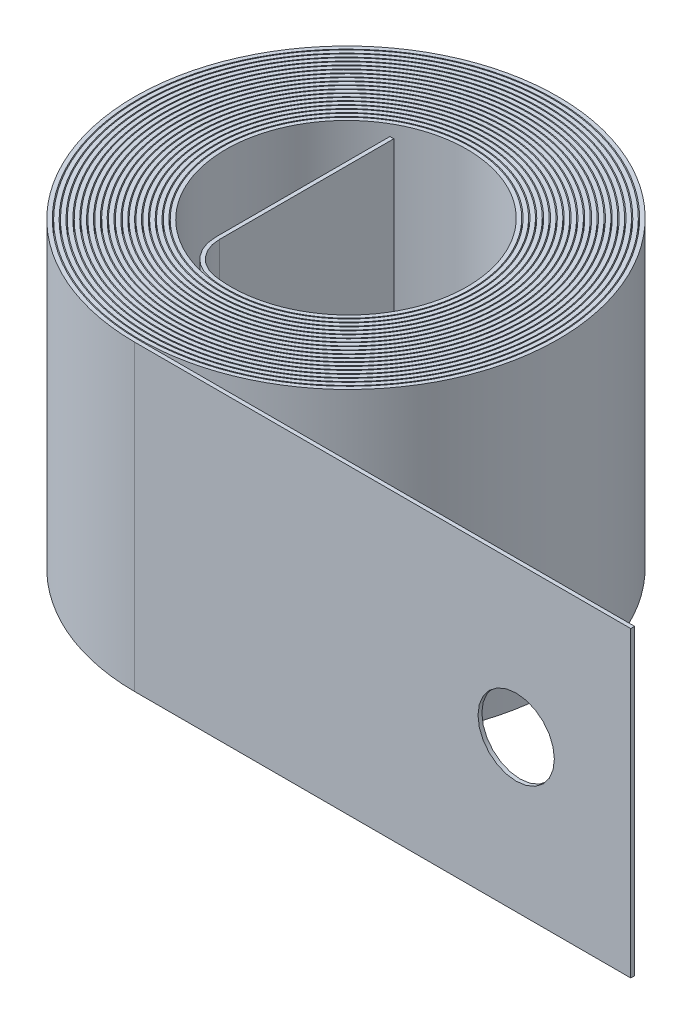
from build123d import *

# Parameters (mm, degrees)
EXTRUDE_THIN1_DEPTH = 7.9248
CUT_EXTRUDE1_REACH  = 19.203
SKETCH3_R           = 1
CUT_EXTRUDE2_REACH  = 20.849
SKETCH4_R           = 1


# Read off the part's stored shape, not the designer's step: Extrude-Thin1
with BuildPart() as part:
    # Extrude-Thin1 outline → Extrude-Thin1 (new body)
    with BuildSketch(Plane(origin=(0, 0, 0), x_dir=(1, 0, 0), z_dir=(0, 1, 0))):
        with BuildLine():
            Line((-1.210137691, -2.148511851), (-1.210137691, 2.416990738))
            Line((-1.210137691, 2.416990738), (-1.311737691, 2.416990738))
            Line((-1.311737691, 2.416990738), (-1.311737691, -2.148511851))
            ThreePointArc((-1.311737691, -2.148511851), (-1.073564108, -2.796293072), (-0.47249667, -3.135505544))
            add(Edge.make_bspline(
                [(0, -5.588), (-0.868617644, -5.584858073), (-1.73504116, -5.375606078), (-3.281339184, -4.590230038), (-3.96001627, -4.014736048), (-4.986347668, -2.620339653), (-5.333217056, -1.802536567), (-5.622523806, -0.098464806), (-5.564754712, 0.786471272), (-5.057851198, 2.435861002), (-4.609130852, 3.199033709), (-3.416788601, 4.442276836), (-2.674110908, 4.921390914), (-1.052864693, 5.494808097), (-0.175567394, 5.588682273), (1.527475673, 5.372300476), (2.35189537, 5.062232649), (3.773370618, 4.104875727), (4.369328184, 3.458349635), (5.207141535, 1.966653451), (5.448360757, 1.12265657), (5.525888712, -0.583526265), (5.362156452, -1.444380355), (4.665474672, -3.000562818), (4.13308643, -3.694685196), (2.813381258, -4.769610173), (2.027106139, -5.149589354), (0.367874111, -5.515742025), (-0.50378424, -5.501648928), (-2.147634466, -5.08340789), (-2.918548795, -4.67960512), (-4.196610968, -3.568842401), (-4.7027746, -2.862763673), (-5.343837892, -1.298679477), (-5.47825551, -0.441901538), (-5.347854416, 1.240483382), (-5.083156875, 2.064779454), (-4.211766629, 3.506383295), (-3.605770383, 4.122576567), (-2.181737737, 5.016897492), (-1.36482259, 5.294344008), (0.306338555, 5.452624756), (1.159279051, 5.333354931), (2.720431618, 4.724416775), (3.427432931, 4.235241645), (4.546138944, 2.991582651), (4.95698545, 2.238082004), (5.396296112, 0.627056872), (5.424436382, -0.229205729), (5.093075872, -1.862857532), (4.733852701, -2.638976209), (3.705167926, -3.946900128), (3.036524125, -4.477697125), (1.532269479, -5.182205338), (0.697840367, -5.355384635), (-0.959621844, -5.308410474), (-1.781362519, -5.088313158), (-3.238143591, -4.302522265), (-3.87205682, -3.737458847), (-4.818301267, -2.382981861), (-5.129910313, -1.594636085), (-5.365700678, 0.037759264), (-5.289717362, 0.880532624), (-4.767306799, 2.441859388), (-4.321305581, 3.159200996), (-3.15475764, 4.316862225), (-2.435134676, 4.756292604), (-0.875430553, 5.264931378), (-0.03657216, 5.33376153), (1.582384587, 5.08725937), (2.361222934, 4.772138637), (3.694088469, 3.825742942), (4.247087185, 3.195222164), (5.010743487, 1.753191425), (5.220822584, 0.942815514), (5.254513678, -0.685660443), (5.078118893, -1.502489717), (4.377284242, -2.969582907), (3.853408696, -3.618710756), (2.570094566, -4.612248003), (1.811669033, -4.955897768), (0.22155011, -5.265785125), (-0.608899104, -5.23180012), (-2.165736633, -4.794445117), (-2.89091574, -4.391435076), (-4.082709843, -3.30277507), (-4.548408279, -2.617988767), (-5.122419242, -1.112461059), (-5.230302211, -0.292901061), (-5.066407663, 1.307038466), (-4.794777403, 2.086171874), (-3.930599602, 3.439112177), (-3.338742642, 4.011874147), (-1.961054187, 4.830302672), (-1.176307385, 5.075347543), (0.41932975, 5.186747882), (1.228973971, 5.053035905), (2.701615399, 4.436246258), (3.363471336, 3.953667736), (4.399640808, 2.742838852), (4.773160848, 2.015545737), (5.153578198, 0.470972951), (5.160197685, -0.345097137), (4.806180326, -1.892927886), (4.445838664, -2.623485435), (3.43555851, -3.844610067), (2.786423165, -4.334236986), (1.337663866, -4.969554279), (0.539177921, -5.114766907), (-1.037608124, -5.031012943), (-1.814679208, -4.802131166), (-3.182896429, -4.019823585), (-3.772984903, -3.467024992), (-4.641747408, -2.155519382), (-4.919759978, -1.397846243), (-5.105733272, 0.16131959), (-5.013568285, 0.961593668), (-4.479652733, 2.435135126), (-4.038337013, 3.107259639), (-2.901032031, 4.1813876), (-2.205943373, 4.582567301), (-0.709938995, 5.029808658), (0.089804105, 5.075540108), (1.624269142, 4.802907417), (2.357797454, 4.484775161), (3.603486488, 3.553085758), (4.114687129, 2.940271043), (4.807151216, 1.550604984), (4.987891927, 0.774846421), (4.981608073, -0.774846421), (4.794607914, -1.547571861), (4.093553083, -2.926352414), (3.58006269, -3.531340779), (2.3363018, -4.445953272), (1.607013118, -4.754879624), (0.087722736, -5.012123763), (-0.701090506, -4.960260106), (-2.171013305, -4.507797289), (-2.85098191, -4.107569739), (-3.958397968, -3.044545608), (-4.38499503, -2.382592366), (-4.895231067, -0.937925627), (-4.978490395, -0.156345614), (-4.785065795, 1.360565413), (-4.508552105, 2.094715549), (-3.655388183, 3.360254953), (-3.07941968, 3.890667872), (-1.750901738, 4.636041892), (-0.999398225, 4.850438534), (0.519468069, 4.918764217), (1.285645099, 4.772659444), (2.670374429, 4.15197761), (3.287854474, 3.677902545), (4.243803782, 2.503169645), (4.581542436, 1.803440534), (4.906604324, 0.32719407), (4.893693026, -0.448167463), (4.521021086, -1.910095656), (4.161570067, -2.595526677), (3.17330498, -3.731580051), (2.545276578, -4.181328965), (1.15445901, -4.75062287), (0.392762215, -4.869741803), (-1.102588414, -4.753137187), (-1.835077235, -4.517524048), (-3.115820553, -3.742549888), (-3.663086035, -3.203810116), (-4.457072198, -1.938223375), (-4.703190009, -1.212374061), (-4.843088382, 0.272147706), (-4.736779228, 1.029660246), (-4.195336667, 2.415837061), (-3.760643812, 3.043427069), (-2.655944605, 4.036187273), (-1.986813073, 4.40059752), (-0.556536862, 4.789888219), (0.203486927, 4.814483803), (1.65319986, 4.51971101), (2.34176196, 4.2005917), (3.501837462, 3.287288962), (3.972457948, 2.693833333), (4.596781433, 1.35911505), (4.750015062, 0.618901883), (4.707643423, -0.851074367), (4.512090707, -1.579691273), (3.814706711, -2.871074674), (3.313436628, -3.43284302), (2.112291498, -4.27109899), (1.413364635, -4.54694868), (-0.033518132, -4.755220852), (-0.780342533, -4.687500166), (-2.163592459, -4.223918245), (-2.798945098, -3.828437147), (-3.823993791, -2.794501742), (-4.212904049, -2.156867748), (-4.662714182, -0.775240462), (-4.723281704, -0.032331028), (-4.504297737, 1.401113137), (-4.22493636, 2.090532571), (-3.386529142, 3.27006625), (-2.828153247, 3.759271631), (-1.551520179, 4.434521036), (-0.834268037, 4.620055533), (0.606721958, 4.649144104), (1.329335289, 4.492694988), (2.626892116, 3.872045065), (3.200831793, 3.40834603), (4.078987002, 2.272880318), (4.382532906, 1.602011361), (4.655832547, 0.195831308), (4.625392227, -0.538379093), (4.238057186, -1.914467702), (3.881483405, -2.555277694), (2.918769208, -3.608112011), (2.313394211, -4.019328171), (0.982842254, -4.525843539), (0.258710212, -4.620765838), (-1.154589938, -4.475253664), (-1.842657512, -4.234952109), (-3.037151911, -3.47110907), (-3.542657406, -2.948179901), (-4.264669845, -1.731351967), (-4.480630314, -1.038412416), (-4.578234175, 0.370190427), (-4.459820884, 1.084753504), (-3.914800624, 2.384128305), (-3.488636819, 2.967933916), (-2.419816734, 3.881605755), (-1.778006927, 4.210774043), (-0.415356174, 4.545622296), (0.304417096, 4.551059984), (1.669262281, 4.238133408), (2.313273822, 3.920032274), (3.389426183, 3.028727788), (3.820739924, 2.456234776), (4.380057271, 1.17892861), (4.507642412, 0.475119724), (4.43309072, -0.914349778), (4.231031523, -1.598927494), (3.541163274, -2.803966474), (3.053909326, -3.32349736), (1.898339562, -4.088066864), (1.230935984, -4.332525298), (-0.14209781, -4.495541394), (-0.846654603, -4.413991255), (-2.143616583, -3.943256849), (-2.735016646, -3.554458145), (-3.679826487, -2.552980232), (-4.032513393, -1.941095676), (-4.425314051, -0.624558229), (-4.465140065, 0.079062035), (-4.224569985, 1.428745693), (-3.944380765, 2.073759601), (-3.124410267, 3.16881313), (-2.585284273, 3.618010173), (-1.363135685, 4.226153052), (-0.681075198, 4.384641927), (0.681075198, 4.378358073), (1.360102561, 4.21360975), (2.571365644, 3.596876127), (3.102665288, 3.145389332), (3.905558877, 2.052263947), (4.176542191, 1.411489669), (4.40172372, 0.076980666), (4.355765499, -0.61570974), (3.957743381, -1.906165608), (3.606008627, -2.502930111), (2.672302616, -3.474519099), (2.091073823, -3.848599147), (0.822986561, -4.295654036), (0.137123835, -4.368298517), (-1.193655154, -4.197831114), (-1.837535729, -3.954871562), (-2.947139287, -3.20590064), (-3.412007561, -2.700489724), (-4.064942248, -1.535150025), (-4.25251631, -0.876139879), (-4.311639723, 0.455409872), (-4.183162435, 1.126909844), (-3.638480549, 2.34018604), (-3.222718661, 2.881023752), (-2.192958032, 3.717997392), (-1.579774929, 4.013495517), (-0.286514029, 4.297466623), (0.392550687, 4.285737124), (1.672556845, 3.958634281), (2.272504559, 3.643535014), (3.266549134, 2.77776756), (3.659883331, 2.227789484), (4.157407849, 1.010238543), (4.261228096, 0.343622893), (4.158419958, -0.964693445), (3.951891221, -1.605375015), (3.273333147, -2.725257812), (2.80184985, -3.203595503), (1.694709013, -3.897246903), (1.059925533, -4.11203601), (-0.237956857, -4.233552009), (-0.900041441, -4.140203524), (-2.111242505, -3.666256559), (-2.659421207, -3.286045979), (-3.526235603, -2.320306559), (-3.84420959, -1.735544142), (-4.183480326, -0.486016851), (-4.204531225, 0.177768126), (-3.946346147, 1.443542188), (-3.667330698, 2.044547712), (-2.869409998, 3.056774797), (-2.351142541, 3.467218771), (-1.185960622, 4.011357528), (-0.539963398, 4.144645488), (0.74252689, 4.106876371), (1.378020027, 3.935868256), (2.504005757, 3.326891157), (2.993629219, 2.889414408), (3.723896713, 1.841601134), (3.963987046, 1.232093186), (4.144741027, -0.029276999), (4.085282971, -0.680152442), (3.68052969, -1.88532553), (3.335568714, -2.4386892), (2.434245844, -3.331125358), (1.878600819, -3.669515495), (0.675050371, -4.060496987), (0.028089896, -4.112801878), (-1.219841687, -3.921336103), (-1.819842207, -3.677734084), (-2.846044031, -2.947315342), (-3.271456077, -2.461084331), (-3.858298584, -1.349848933), (-4.019288481, -0.72572056), (-4.043774531, 0.527783473), (-3.907271083, 1.15618086), (-3.366805888, 2.284201324), (-2.963283364, 2.782952829), (-1.975666069, 3.545726), (-1.39235369, 3.809168043), (-0.170112506, 4.045879968), (0.467859082, 4.018984334), (1.663198771, 3.681669256), (2.219639648, 3.371531734), (3.133514178, 2.534763346), (3.490248062, 2.008799654), (3.929267835, 0.853223449), (4.011229464, 0.224519363), (3.884099664, -1.002141409), (3.675126814, -1.59914315), (3.011618538, -2.635191645), (2.55761716, -3.073440665), (1.501649747, -3.699037018), (0.900517447, -3.885913085), (-0.321051104, -3.969720468), (-0.940533037, -3.866605862), (-2.06664121, -3.393354989), (-2.572396495, -3.023605902), (-3.363570702, -2.096794616), (-3.648387238, -1.540468116), (-3.937666394, -0.359739398), (-3.941922283, 0.263737055), (-3.670086489, 1.445596676), (-3.394225884, 2.003062209), (-2.621897066, 2.934242299), (-2.126046386, 3.307242863), (-1.020193355, 3.790560262), (-0.411061527, 3.900517917), (0.791091432, 3.835168497), (1.383175781, 3.659931879), (2.425036518, 3.062502963), (2.874009816, 2.640793661), (3.53438632, 1.641159741), (3.745290617, 1.064025724), (3.885349516, -0.12287603), (3.814414224, -0.731715537), (3.406860966, -1.852098041), (3.070579277, -2.362773654), (2.204928433, -3.178265374), (1.676247979, -3.482459485), (0.539177463, -3.820819444), (-0.068319965, -3.854740022), (-1.233222244, -3.646232552), (-1.789721748, -3.40398637), (-2.734139772, -2.695734776), (-3.121333218, -2.230297503), (-3.645154888, -1.175666385), (-3.781391927, -0.587303975), (-3.775108073, 0.587303975), (-3.632611586, 1.172633262), (-3.100199172, 2.216378875), (-2.710715975, 2.673989797), (-1.768226094, 3.365164481), (-1.21596622, 3.598204759), (-0.066238596, 3.791323677), (0.530328974, 3.751270892), (1.641317911, 3.407689473), (2.154878312, 3.104447514), (2.990640231, 2.300059623), (3.312203263, 1.799555281), (3.696077005, 0.708047496), (3.758106639, 0.117902055), (3.610596434, -1.026744894), (3.401191018, -1.580355908), (2.756413097, -2.534023622), (2.321559768, -2.93334725), (1.319398311, -3.493842604), (0.752881533, -3.654594087), (-0.391351675, -3.704515228), (-0.968174588, -3.593665426), (-2.00999765, -3.124983487), (-2.47419303, -2.767534777), (-3.192191002, -1.882746419), (-3.445448598, -1.356109324), (-3.688328922, -0.245833988), (-3.677781222, 0.33693391), (-3.396247476, 1.435018035), (-3.125499961, 1.949482441), (-2.382230139, 2.801518217), (-1.91030239, 3.138437696), (-0.866018076, 3.564192827), (-0.29448357, 3.652714389), (0.826798476, 3.563702729), (1.375672795, 3.386258394), (2.334695071, 2.804116406), (2.744104971, 2.399889584), (3.337421609, 1.45119465), (3.52088201, 0.907477004), (3.624015635, -0.203766008), (3.54362782, -0.770422636), (3.137176451, -1.806647948), (2.811448147, -2.275415345), (1.984668512, -3.016283932), (1.48427521, -3.28782166), (0.415496841, -3.577072433), (-0.152049324, -3.594578646), (-1.233884516, -3.372981285), (-1.747333463, -3.134069697), (-2.611712131, -2.451531034), (-2.961979594, -2.00845175), (-3.425933623, -1.012806193), (-3.539275915, -0.461024913), (-3.50610932, 0.633979413), (-3.359645804, 1.176348781), (-2.839075602, 2.13693684), (-2.465392189, 2.554415419), (-1.57091077, 3.176694436), (-1.050821736, 3.381025413), (0.025035867, 3.534261201), (0.57996235, 3.483065776), (1.607058602, 3.137141136), (2.078433302, 2.842700281), (2.838256925, 2.073989946), (3.12612694, 1.600333891), (3.458279792, 0.57486028), (3.502322053, 0.023848763), (3.33837447, -1.038570237), (3.130531807, -1.549151843), (2.508101542, -2.422021811), (2.094015414, -2.783640523), (1.148177687, -3.282076133), (0.617173083, -3.41852143), (-0.448844989, -3.438404957), (-0.983026431, -3.321847177), (-1.941510533, -2.861566711), (-2.365073865, -2.518220699), (-3.012464999, -1.678451821), (-3.235803181, -1.182696018), (-3.43592739, -0.144393705), (-3.412576441, 0.397339072), (-3.125281326, 1.411929839), (-2.861580063, 1.884001601), (-2.150757484, 2.658916345), (-1.704205098, 2.961167954), (-0.723604644, 3.332692132), (-0.190328514, 3.401693091), (0.84969288, 3.292945665), (1.355628788, 3.11530152), (2.233231379, 2.552128005), (2.604223924, 2.167054419), (3.133404191, 1.271947527), (3.291195856, 0.762622479), (3.361206761, -0.271911781), (3.273390841, -0.79631257), (2.871909355, -1.749154116), (2.558574985, -2.176859075), (1.773772498, -2.845535649), (1.302929306, -3.086000433), (0.304122621, -3.329710492), (-0.223057013, -3.332784581), (-1.221931071, -3.10203957), (-1.692850596, -2.868419494), (-2.479058415, -2.215066344), (-2.793745801, -1.795857997), (-3.201063253, -0.861458099), (-3.293393423, -0.347003331), (-3.237246274, 0.667833086), (-3.088832235, 1.167424068), (-2.583842652, 2.046106563), (-2.227677995, 2.424522273), (-1.38397992, 2.980705776), (-0.897115465, 3.158055936), (0.10365425, 3.275157638), (0.616776472, 3.214837193), (1.560579498, 2.870465082), (1.990530661, 2.586700408), (2.676704262, 1.856876634), (2.932405576, 1.411400282), (3.216324838, 0.453796697), (3.244339979, -0.057577895), (3.06789512, -1.037698795), (2.863591974, -1.505683895), (2.267059285, -2.299466414), (1.875310734, -2.624656262), (0.846026979, -3.134591699), (0.171179762, -3.240345896), (-0.47249667, -3.135505544)],
                knots=[0, 0, 0, 0, 0.00390625, 0.00390625, 0.0078125, 0.0078125, 0.01171875, 0.01171875, 0.015625, 0.015625, 0.01953125, 0.01953125, 0.0234375, 0.0234375, 0.02734375, 0.02734375, 0.03125, 0.03125, 0.03515625, 0.03515625, 0.0390625, 0.0390625, 0.04296875, 0.04296875, 0.046875, 0.046875, 0.05078125, 0.05078125, 0.0546875, 0.0546875, 0.05859375, 0.05859375, 0.0625, 0.0625, 0.06640625, 0.06640625, 0.0703125, 0.0703125, 0.07421875, 0.07421875, 0.078125, 0.078125, 0.08203125, 0.08203125, 0.0859375, 0.0859375, 0.08984375, 0.08984375, 0.09375, 0.09375, 0.09765625, 0.09765625, 0.1015625, 0.1015625, 0.10546875, 0.10546875, 0.109375, 0.109375, 0.11328125, 0.11328125, 0.1171875, 0.1171875, 0.12109375, 0.12109375, 0.125, 0.125, 0.12890625, 0.12890625, 0.1328125, 0.1328125, 0.13671875, 0.13671875, 0.140625, 0.140625, 0.14453125, 0.14453125, 0.1484375, 0.1484375, 0.15234375, 0.15234375, 0.15625, 0.15625, 0.16015625, 0.16015625, 0.1640625, 0.1640625, 0.16796875, 0.16796875, 0.171875, 0.171875, 0.17578125, 0.17578125, 0.1796875, 0.1796875, 0.18359375, 0.18359375, 0.1875, 0.1875, 0.19140625, 0.19140625, 0.1953125, 0.1953125, 0.19921875, 0.19921875, 0.203125, 0.203125, 0.20703125, 0.20703125, 0.2109375, 0.2109375, 0.21484375, 0.21484375, 0.21875, 0.21875, 0.22265625, 0.22265625, 0.2265625, 0.2265625, 0.23046875, 0.23046875, 0.234375, 0.234375, 0.23828125, 0.23828125, 0.2421875, 0.2421875, 0.24609375, 0.24609375, 0.25, 0.25, 0.25390625, 0.25390625, 0.2578125, 0.2578125, 0.26171875, 0.26171875, 0.265625, 0.265625, 0.26953125, 0.26953125, 0.2734375, 0.2734375, 0.27734375, 0.27734375, 0.28125, 0.28125, 0.28515625, 0.28515625, 0.2890625, 0.2890625, 0.29296875, 0.29296875, 0.296875, 0.296875, 0.30078125, 0.30078125, 0.3046875, 0.3046875, 0.30859375, 0.30859375, 0.3125, 0.3125, 0.31640625, 0.31640625, 0.3203125, 0.3203125, 0.32421875, 0.32421875, 0.328125, 0.328125, 0.33203125, 0.33203125, 0.3359375, 0.3359375, 0.33984375, 0.33984375, 0.34375, 0.34375, 0.34765625, 0.34765625, 0.3515625, 0.3515625, 0.35546875, 0.35546875, 0.359375, 0.359375, 0.36328125, 0.36328125, 0.3671875, 0.3671875, 0.37109375, 0.37109375, 0.375, 0.375, 0.37890625, 0.37890625, 0.3828125, 0.3828125, 0.38671875, 0.38671875, 0.390625, 0.390625, 0.39453125, 0.39453125, 0.3984375, 0.3984375, 0.40234375, 0.40234375, 0.40625, 0.40625, 0.41015625, 0.41015625, 0.4140625, 0.4140625, 0.41796875, 0.41796875, 0.421875, 0.421875, 0.42578125, 0.42578125, 0.4296875, 0.4296875, 0.43359375, 0.43359375, 0.4375, 0.4375, 0.44140625, 0.44140625, 0.4453125, 0.4453125, 0.44921875, 0.44921875, 0.453125, 0.453125, 0.45703125, 0.45703125, 0.4609375, 0.4609375, 0.46484375, 0.46484375, 0.46875, 0.46875, 0.47265625, 0.47265625, 0.4765625, 0.4765625, 0.48046875, 0.48046875, 0.484375, 0.484375, 0.48828125, 0.48828125, 0.4921875, 0.4921875, 0.49609375, 0.49609375, 0.5, 0.5, 0.50390625, 0.50390625, 0.5078125, 0.5078125, 0.51171875, 0.51171875, 0.515625, 0.515625, 0.51953125, 0.51953125, 0.5234375, 0.5234375, 0.52734375, 0.52734375, 0.53125, 0.53125, 0.53515625, 0.53515625, 0.5390625, 0.5390625, 0.54296875, 0.54296875, 0.546875, 0.546875, 0.55078125, 0.55078125, 0.5546875, 0.5546875, 0.55859375, 0.55859375, 0.5625, 0.5625, 0.56640625, 0.56640625, 0.5703125, 0.5703125, 0.57421875, 0.57421875, 0.578125, 0.578125, 0.58203125, 0.58203125, 0.5859375, 0.5859375, 0.58984375, 0.58984375, 0.59375, 0.59375, 0.59765625, 0.59765625, 0.6015625, 0.6015625, 0.60546875, 0.60546875, 0.609375, 0.609375, 0.61328125, 0.61328125, 0.6171875, 0.6171875, 0.62109375, 0.62109375, 0.625, 0.625, 0.62890625, 0.62890625, 0.6328125, 0.6328125, 0.63671875, 0.63671875, 0.640625, 0.640625, 0.64453125, 0.64453125, 0.6484375, 0.6484375, 0.65234375, 0.65234375, 0.65625, 0.65625, 0.66015625, 0.66015625, 0.6640625, 0.6640625, 0.66796875, 0.66796875, 0.671875, 0.671875, 0.67578125, 0.67578125, 0.6796875, 0.6796875, 0.68359375, 0.68359375, 0.6875, 0.6875, 0.69140625, 0.69140625, 0.6953125, 0.6953125, 0.69921875, 0.69921875, 0.703125, 0.703125, 0.70703125, 0.70703125, 0.7109375, 0.7109375, 0.71484375, 0.71484375, 0.71875, 0.71875, 0.72265625, 0.72265625, 0.7265625, 0.7265625, 0.73046875, 0.73046875, 0.734375, 0.734375, 0.73828125, 0.73828125, 0.7421875, 0.7421875, 0.74609375, 0.74609375, 0.75, 0.75, 0.75390625, 0.75390625, 0.7578125, 0.7578125, 0.76171875, 0.76171875, 0.765625, 0.765625, 0.76953125, 0.76953125, 0.7734375, 0.7734375, 0.77734375, 0.77734375, 0.78125, 0.78125, 0.78515625, 0.78515625, 0.7890625, 0.7890625, 0.79296875, 0.79296875, 0.796875, 0.796875, 0.80078125, 0.80078125, 0.8046875, 0.8046875, 0.80859375, 0.80859375, 0.8125, 0.8125, 0.81640625, 0.81640625, 0.8203125, 0.8203125, 0.82421875, 0.82421875, 0.828125, 0.828125, 0.83203125, 0.83203125, 0.8359375, 0.8359375, 0.83984375, 0.83984375, 0.84375, 0.84375, 0.84765625, 0.84765625, 0.8515625, 0.8515625, 0.85546875, 0.85546875, 0.859375, 0.859375, 0.86328125, 0.86328125, 0.8671875, 0.8671875, 0.87109375, 0.87109375, 0.875, 0.875, 0.87890625, 0.87890625, 0.8828125, 0.8828125, 0.88671875, 0.88671875, 0.890625, 0.890625, 0.89453125, 0.89453125, 0.8984375, 0.8984375, 0.90234375, 0.90234375, 0.90625, 0.90625, 0.91015625, 0.91015625, 0.9140625, 0.9140625, 0.91796875, 0.91796875, 0.921875, 0.921875, 0.92578125, 0.92578125, 0.9296875, 0.9296875, 0.93359375, 0.93359375, 0.9375, 0.9375, 0.94140625, 0.94140625, 0.9453125, 0.9453125, 0.94921875, 0.94921875, 0.953125, 0.953125, 0.95703125, 0.95703125, 0.9609375, 0.9609375, 0.96484375, 0.96484375, 0.96875, 0.96875, 0.97265625, 0.97265625, 0.9765625, 0.9765625, 0.98046875, 0.98046875, 0.984375, 0.984375, 0.98828125, 0.98828125, 0.9921875, 0.9921875, 0.99609375, 0.99609375, 1.001252042, 1.001252042, 1.001252042, 1.001252042], degree=3))
            Line((0, -5.588), (13, -5.588))
            Line((13, -5.588), (13, -5.4864))
            Line((13, -5.4864), (2e-09, -5.486399323))
            add(Edge.make_bspline(
                [(2e-09, -5.486399323), (-0.853611774, -5.483253465), (-1.705845294, -5.277112535), (-3.224868001, -4.504324252), (-3.891946648, -3.937616338), (-4.898758153, -2.56613554), (-5.238763626, -1.761208065), (-5.519946092, -0.086221473), (-5.461346747, 0.784090377), (-4.959309288, 2.403545261), (-4.516004753, 3.153029608), (-3.340754752, 4.371024941), (-2.608810437, 4.839935142), (-1.013861167, 5.397545116), (-0.150693766, 5.486647952), (1.521617925, 5.26698932), (2.331094735, 4.958562576), (3.72308646, 4.011283852), (4.306075514, 3.372620813), (5.121222131, 1.902711646), (5.353929181, 1.071444204), (5.420027574, -0.605119061), (5.253946647, -1.450678724), (4.559487709, -2.974855208), (4.031504561, -3.653963572), (2.727571505, -4.700537471), (1.951782283, -5.068654687), (0.319189971, -5.415626204), (-0.537752502, -5.395178701), (-2.148931728, -4.97085062), (-2.903617388, -4.567574251), (-4.149118566, -3.465347897), (-4.640635125, -2.766769341), (-5.255560355, -1.224600819), (-5.379802179, -0.381044524), (-5.23495758, 1.269923335), (-4.966673376, 2.077681991), (-4.095702432, 3.484223797), (-3.493612962, 4.083698916), (-2.085229876, 4.946079397), (-1.27918173, 5.209906427), (0.363711724, 5.345752836), (1.200747259, 5.218747019), (2.726205654, 4.601610621), (3.41525059, 4.112303789), (4.497679566, 2.876758153), (4.892018941, 2.131003383), (5.301669482, 0.543308778), (5.318089854, -0.298616514), (4.969819529, -1.897889811), (4.606165117, -2.655730091), (3.577118159, -3.92475593), (2.912461453, -4.436870145), (1.42499989, -5.105627648), (0.602452457, -5.263465547), (-1.023889011, -5.191191383), (-1.827989737, -4.962300205), (-3.245145009, -4.167108379), (-3.859038821, -3.601794221), (-4.764902708, -2.256232613), (-5.058095415, -1.476511636), (-5.26092435, 0.129872352), (-5.17192538, 0.956607799), (-4.630918264, 2.479572474), (-4.180131521, 3.176489741), (-3.013603306, 4.29086866), (-2.298670007, 4.709518023), (-0.758188364, 5.178645347), (0.067159262, 5.230580452), (1.651022945, 4.956549434), (2.410018034, 4.63200982), (3.698625448, 3.67609222), (4.229325145, 3.045802297), (4.948373535, 1.614773075), (5.138211594, 0.814534598), (5.136121941, -0.78405099), (4.945783118, -1.582617392), (4.225645945, -3.006522254), (3.697199019, -3.632783042), (2.415546808, -4.578356889), (1.663155813, -4.899125638), (0.095946043, -5.166057911), (-0.718791272, -5.113918826), (-2.235591691, -4.647667682), (-2.938351266, -4.235139572), (-4.080787967, -3.13805084), (-4.521818449, -2.454616736), (-5.04713852, -0.963471838), (-5.133171244, -0.156172303), (-4.931402072, 1.408912291), (-4.645372565, 2.167114052), (-3.762332054, 3.471408368), (-3.166743588, 4.018683714), (-1.793669798, 4.784434009), (-1.016940901, 5.004628906), (0.550918545, 5.07020451), (1.342141736, 4.917490397), (2.769014597, 4.271492869), (3.405611857, 3.779897153), (4.387110116, 2.563035198), (4.733635748, 1.838871125), (5.061688386, 0.313320894), (5.045188336, -0.487801498), (4.652146624, -1.99488071), (4.277513259, -2.701491931), (3.250080405, -3.868117868), (2.59871412, -4.329589752), (1.15883553, -4.90774726), (0.370961992, -5.026401828), (-1.172115433, -4.894766194), (-1.927631979, -4.646548204), (-3.243777021, -3.835934344), (-3.805626236, -3.27527294), (-4.614452699, -1.961474485), (-4.863319335, -1.209354813), (-4.993916878, 0.324973128), (-4.877817209, 1.107115603), (-4.304859512, 2.533266384), (-3.849993188, 3.178196239), (-2.698596258, 4.191832074), (-2.003449652, 4.562271705), (-0.521860866, 4.94836804), (0.26411413, 4.966217237), (1.758036867, 4.644672404), (2.466553389, 4.307470507), (3.653534108, 3.349707069), (4.133502615, 2.730868611), (4.761081598, 1.343989471), (4.910828954, 0.576825154), (4.847056201, -0.941165146), (4.635861072, -1.69216519), (3.897029822, -3.016393107), (3.371413484, -3.590828078), (2.118006734, -4.439079031), (1.39149375, -4.714896201), (-0.106667392, -4.907757816), (-0.878066649, -4.827184222), (-2.29990567, -4.325987904), (-2.95119613, -3.907625763), (-3.993192128, -2.822164058), (-4.385684927, -2.156718859), (-4.826664846, -0.721206551), (-4.87750962, 0.048175683), (-4.625590701, 1.525636045), (-4.325260866, 2.234160599), (-3.436980862, 3.437706014), (-2.851022398, 3.934227023), (-1.518677798, 4.607761539), (-0.773409365, 4.787024803), (0.716568238, 4.788710718), (1.461285218, 4.613663757), (2.789906024, 3.945782513), (3.374957787, 3.455223386), (4.258966403, 2.2631214), (4.559982474, 1.563109475), (4.812245477, 0.103575711), (4.766036148, -0.655496195), (4.335150723, -2.069542695), (3.952966819, -2.725258762), (2.933708035, -3.791857507), (2.298541655, -4.204530435), (0.911031081, -4.697160751), (0.159597363, -4.779588716), (-1.298231348, -4.59527429), (-2.004920303, -4.331164469), (-3.221294751, -3.511986242), (-3.732430429, -2.959153162), (-4.448415264, -1.682679051), (-4.655575236, -0.960395027), (-4.720191127, 0.498804468), (-4.580335806, 1.235540427), (-3.982388913, 2.564951236), (-3.526795294, 3.158675334), (-2.396708587, 4.074770358), (-1.72398839, 4.399208956), (-0.305363739, 4.707915763), (0.439878147, 4.694840248), (1.842768434, 4.3326502), (2.501017012, 3.986220743), (3.588491509, 3.033232671), (4.019465013, 2.428816366), (4.560449937, 1.091040646), (4.672995236, 0.358819358), (4.55412172, -1.076351862), (4.325490907, -1.779419561), (3.574841468, -3.004951609), (3.055273725, -3.528775943), (1.835806389, -4.28367732), (1.137495874, -4.517078021), (-0.288325542, -4.641980042), (-1.015454767, -4.536282369), (-2.342148699, -4.007077078), (-2.942630392, -3.586255682), (-3.887146768, -2.51869355), (-4.233212443, -1.873951727), (-4.595320658, -0.498335486), (-4.614084783, 0.231658004), (-4.318816956, 1.620153189), (-4.007623434, 2.279087825), (-3.120777083, 3.383751727), (-2.547476614, 3.831145367), (-1.260974922, 4.41713705), (-0.549136207, 4.558285678), (0.860501466, 4.502555925), (1.558224351, 4.308578036), (2.789316328, 3.625697896), (3.323920547, 3.139431621), (4.114186808, 1.977907711), (4.372141041, 1.304459383), (4.554579751, -0.085554191), (4.481932787, -0.801526602), (4.020105643, -2.122101333), (3.633764116, -2.727460647), (2.6290365, -3.696750028), (2.012855655, -4.062633896), (0.682161625, -4.47502653), (-0.031251941, -4.524277423), (-1.40224526, -4.294008779), (-2.060070679, -4.017441291), (-3.178288309, -3.196414525), (-3.640226309, -2.654491101), (-4.267835421, -1.420607415), (-4.4360306, -0.730225987), (-4.441022789, 0.651157738), (-4.280790721, 1.341878236), (-3.664739188, 2.575015471), (-3.211708568, 3.118513338), (-2.108865687, 3.940585574), (-1.461067103, 4.221380497), (-0.109116665, 4.458510607), (0.594227608, 4.417739128), (1.905393552, 4.021762772), (2.513790168, 3.669512445), (3.504231271, 2.727732325), (3.88811661, 2.140591281), (4.347612411, 0.856545258), (4.425943617, 0.160954019), (4.258609327, -1.189569678), (4.015970133, -1.844546114), (3.260251811, -2.972742248), (2.749863307, -3.447358952), (1.569745708, -4.113165279), (0.901799493, -4.306812882), (-0.448770925, -4.369989664), (-1.130901099, -4.242519524), (-2.362660836, -3.692180456), (-2.913193809, -3.272219863), (-3.763516406, -2.228597693), (-4.065419095, -1.607134876), (-4.354309399, -0.29532468), (-4.344174673, 0.394001759), (-4.012365029, 1.692589852), (-3.693723902, 2.302227811), (-2.814810222, 3.310236605), (-2.257084572, 3.710304397), (-1.021222383, 4.213668255), (-0.344604747, 4.319624929), (0.982627007, 4.213026792), (1.633074321, 4.003534046), (2.767743707, 3.312428645), (3.253188935, 2.833631089), (3.953751959, 1.708231619), (4.171225954, 1.063600674), (4.289943837, -0.253762995), (4.194179318, -0.925787957), (3.708267309, -2.152847929), (3.321113685, -2.708590169), (2.337055665, -3.583621242), (1.742512977, -3.90488423), (0.472738744, -4.242527677), (-0.201264388, -4.261732356), (-1.484233468, -3.992256196), (-2.093365689, -3.706652132), (-3.115405374, -2.890333243), (-3.529839775, -2.362296172), (-4.073793185, -1.175962262), (-4.205877347, -0.519376662), (-4.157692489, 0.781892224), (-3.980484163, 1.426193797), (-3.353116877, 2.563910388), (-2.905866201, 3.058354672), (-1.835941266, 3.790224106), (-1.215406996, 4.029872022), (0.066526775, 4.201390959), (0.727007838, 4.136207867), (1.946154477, 3.713274848), (2.505317702, 3.358570322), (3.401539392, 2.434225853), (3.740406182, 1.867086157), (4.123730059, 0.641059571), (4.170923171, -0.016401339), (3.961806016, -1.280845086), (3.708580153, -1.887777686), (2.95439775, -2.920368451), (2.45622114, -3.347362179), (1.32056771, -3.928593719), (0.684978297, -4.085269557), (-0.587813667, -4.093059411), (-1.224420067, -3.947197382), (-2.361845943, -3.382519677), (-2.863485641, -2.966673726), (-3.623211887, -1.952785048), (-3.883360276, -1.357029696), (-4.104853437, -0.112574833), (-4.06906434, 0.535002751), (-3.707506578, 1.743139015), (-3.384801313, 2.303977176), (-2.520128494, 3.217905787), (-1.980773594, 3.572616301), (-0.800020192, 3.998492515), (-0.160231807, 4.072274531), (1.082921634, 3.921408887), (1.686018044, 3.699819236), (2.725746564, 3.007132789), (3.163506191, 2.538888586), (3.778681999, 1.454875283), (3.958381212, 0.841150775), (4.019600728, -0.400812069), (3.90407503, -1.02824448), (3.400870635, -2.162138437), (3.016191413, -2.669200694), (2.058707526, -3.453345214), (1.488313957, -3.732305096), (0.283209553, -4.000868795), (-0.350186722, -3.993227784), (-1.544339519, -3.691293256), (-2.105153301, -3.400048517), (-3.033349237, -2.594817394), (-3.402145218, -2.083528754), (-3.867400632, -0.949386364), (-3.966328605, -0.328310408), (-3.871482491, 0.890935135), (-3.680707725, 1.48862), (-3.048699388, 2.532148664), (-2.610361231, 2.978899798), (-1.578755388, 3.624674015), (-0.987668192, 3.825801167), (0.221279666, 3.93780825), (0.83813307, 3.851541461), (1.965358857, 3.408432782), (2.47610643, 3.054588948), (3.281251971, 2.153687227), (3.577324256, 1.609138984), (3.889988001, 0.445076345), (3.909195563, -0.172944922), (3.664991677, -1.350272111), (3.404583108, -1.909413246), (2.65837943, -2.848490735), (2.175339156, -3.229621064), (1.088956883, -3.731047866), (0.487541357, -3.853640625), (-0.705331643, -3.812466377), (-1.296094499, -3.651609793), (-2.340170332, -3.079289767), (-2.794162677, -2.670734873), (-3.467187825, -1.69211229), (-3.688125715, -1.124337913), (-3.848190843, 0.049579386), (-3.790042614, 0.654525507), (-3.405497546, 1.772059682), (-3.082067133, 2.28479559), (-2.237736344, 3.107556272), (-1.719417989, 3.419037137), (-0.59790593, 3.77277378), (0.003632874, 3.817481744), (1.161429827, 3.6289834), (1.717305205, 3.398704491), (2.66394178, 2.710933955), (3.055667706, 2.256226056), (3.590033785, 1.218563817), (3.734777169, 0.637663586), (3.744820499, -0.526530248), (3.612914133, -1.108928971), (3.099126476, -2.150392233), (2.720137767, -2.609904522), (1.794884038, -3.306841792), (1.251000774, -3.545956808), (0.113955874, -3.751272818), (-0.477834111, -3.720044513), (-1.582773509, -3.392383636), (-2.095845518, -3.098856988), (-2.932876726, -2.310900366), (-3.258062939, -1.81909809), (-3.649798895, -0.741461234), (-3.718615462, -0.157424256), (-3.583673412, 0.978281458), (-3.382739165, 1.529357031), (-2.752632139, 2.480302742), (-2.326244036, 2.880903016), (-1.338072638, 3.444962309), (-0.778448484, 3.610314424), (0.35492216, 3.669023699), (0.927586177, 3.565032598), (1.963378622, 3.108461456), (2.4267234, 2.758729929), (3.144252827, 1.887042298), (3.399900284, 1.367531194), (3.647592287, 0.269023893), (3.642031734, -0.308442958), (3.369435862, -1.39801174), (3.105218787, -1.909816665), (2.373257608, -2.757824743), (1.908160111, -3.095018916), (0.875537731, -3.521644422), (0.30993228, -3.613139253), (-0.801270461, -3.529488743), (-1.346074935, -3.357039504), (-2.29816127, -2.783656215), (-2.705937155, -2.385480508), (-3.296439946, -1.447382277), (-3.480836443, -0.909700215), (-3.585572158, 0.190869875), (-3.508398785, 0.752503142), (-3.107575028, 1.779675899), (-2.786702353, 2.245204157), (-1.968592101, 2.98003464), (-1.473837194, 3.250564082), (-0.415353678, 3.537699492), (0.146707059, 3.556505826), (1.218263337, 3.337023895), (1.727251152, 3.101441011), (2.583002855, 2.424918667), (2.93051862, 1.986618299), (3.388898011, 0.999963707), (3.501607359, 0.453628519), (3.466877032, -0.630813942), (3.321982489, -1.167942242), (2.804218654, -2.118090734), (2.434055134, -2.531370907), (1.546425078, -3.145074039), (1.031255961, -3.346933383), (-0.034706426, -3.494977811), (-0.584090147, -3.44346657), (-1.599811224, -3.096774815), (-2.065916867, -2.804276153), (-2.814796025, -2.039571499), (-3.098556481, -1.569860326), (-3.422155115, -0.552705937), (-3.463983694, -0.007048366), (-3.295540965, 1.043993644), (-3.08783924, 1.548671391), (-2.466025785, 2.409003086), (-2.054519956, 2.765170173), (-1.114600434, 3.252152139), (-0.588282246, 3.384584016), (0.467301719, 3.396305044), (0.995418234, 3.277968376), (1.94064873, 2.814561262), (2.35779403, 2.472119166), (2.991471017, 1.63516667), (3.209199744, 1.142986062), (3.397766724, 0.113265293), (3.3707086, -0.422729813), (3.076394597, -1.424291196), (2.811701628, -1.889415332), (2.100051139, -2.64913916), (1.655575517, -2.944484334), (0.680873456, -3.301528569), (0.152528541, -3.364995962), (-0.875643276, -3.245402508), (-1.374578767, -3.064754974), (-2.236405348, -2.496752143), (-2.599574562, -2.11194497), (-3.112002365, -1.21934225), (-3.262641725, -0.713695048), (-3.318257145, 0.311095465), (-3.225419316, 0.828937048), (-2.814954208, 1.766375619), (-2.499854693, 2.185783664), (-1.713605751, 2.836234658), (-1.244794067, 3.068232607), (-0.252773106, 3.29447745), (0.268776261, 3.290614742), (1.253600585, 3.046793102), (1.716235636, 2.809257256), (2.483657932, 2.150133752), (2.788951327, 1.730990812), (3.176396275, 0.799681398), (3.260085302, 0.28946969), (3.187044758, -0.713627082), (3.032554396, -1.205452392), (2.517301068, -2.065775886), (2.15900528, -2.434323966), (1.314116553, -2.969045579), (0.829701085, -3.136359513), (-0.162527926, -3.233233741), (-0.668906661, -3.164777917), (-1.595793137, -2.805694977), (-2.015902772, -2.517473829), (-2.679964372, -1.781773779), (-2.924629878, -1.336616702), (-3.185659355, -0.383576058), (-3.203690498, 0.122554355), (-3.008352736, 1.088201136), (-2.797248618, 1.546894756), (-2.189953557, 2.318936305), (-1.796147045, 2.632556255), (-0.908987504, 3.047339929), (-0.417639515, 3.149804738), (0.55833319, 3.120923296), (1.041747916, 2.991627072), (1.897665769, 2.527905166), (2.270000115, 2.195844241), (2.82387827, 1.398883708), (3.006321188, 0.936167269), (3.141749686, -0.021902227), (3.096505762, -0.515707949), (2.787107259, -1.429403053), (2.525217803, -1.848698636), (1.83973458, -2.52325351), (1.41842374, -2.778988533), (0.505464824, -3.071870932), (0.015341993, -3.112024589), (-0.456163557, -3.035226985)],
                knots=[0, 0, 0, 0, 0.00390625, 0.00390625, 0.0078125, 0.0078125, 0.01171875, 0.01171875, 0.015625, 0.015625, 0.01953125, 0.01953125, 0.0234375, 0.0234375, 0.02734375, 0.02734375, 0.03125, 0.03125, 0.03515625, 0.03515625, 0.0390625, 0.0390625, 0.04296875, 0.04296875, 0.046875, 0.046875, 0.05078125, 0.05078125, 0.0546875, 0.0546875, 0.05859375, 0.05859375, 0.0625, 0.0625, 0.06640625, 0.06640625, 0.0703125, 0.0703125, 0.07421875, 0.07421875, 0.078125, 0.078125, 0.08203125, 0.08203125, 0.0859375, 0.0859375, 0.08984375, 0.08984375, 0.09375, 0.09375, 0.09765625, 0.09765625, 0.1015625, 0.1015625, 0.10546875, 0.10546875, 0.109375, 0.109375, 0.11328125, 0.11328125, 0.1171875, 0.1171875, 0.12109375, 0.12109375, 0.125, 0.125, 0.12890625, 0.12890625, 0.1328125, 0.1328125, 0.13671875, 0.13671875, 0.140625, 0.140625, 0.14453125, 0.14453125, 0.1484375, 0.1484375, 0.15234375, 0.15234375, 0.15625, 0.15625, 0.16015625, 0.16015625, 0.1640625, 0.1640625, 0.16796875, 0.16796875, 0.171875, 0.171875, 0.17578125, 0.17578125, 0.1796875, 0.1796875, 0.18359375, 0.18359375, 0.1875, 0.1875, 0.19140625, 0.19140625, 0.1953125, 0.1953125, 0.19921875, 0.19921875, 0.203125, 0.203125, 0.20703125, 0.20703125, 0.2109375, 0.2109375, 0.21484375, 0.21484375, 0.21875, 0.21875, 0.22265625, 0.22265625, 0.2265625, 0.2265625, 0.23046875, 0.23046875, 0.234375, 0.234375, 0.23828125, 0.23828125, 0.2421875, 0.2421875, 0.24609375, 0.24609375, 0.25, 0.25, 0.25390625, 0.25390625, 0.2578125, 0.2578125, 0.26171875, 0.26171875, 0.265625, 0.265625, 0.26953125, 0.26953125, 0.2734375, 0.2734375, 0.27734375, 0.27734375, 0.28125, 0.28125, 0.28515625, 0.28515625, 0.2890625, 0.2890625, 0.29296875, 0.29296875, 0.296875, 0.296875, 0.30078125, 0.30078125, 0.3046875, 0.3046875, 0.30859375, 0.30859375, 0.3125, 0.3125, 0.31640625, 0.31640625, 0.3203125, 0.3203125, 0.32421875, 0.32421875, 0.328125, 0.328125, 0.33203125, 0.33203125, 0.3359375, 0.3359375, 0.33984375, 0.33984375, 0.34375, 0.34375, 0.34765625, 0.34765625, 0.3515625, 0.3515625, 0.35546875, 0.35546875, 0.359375, 0.359375, 0.36328125, 0.36328125, 0.3671875, 0.3671875, 0.37109375, 0.37109375, 0.375, 0.375, 0.37890625, 0.37890625, 0.3828125, 0.3828125, 0.38671875, 0.38671875, 0.390625, 0.390625, 0.39453125, 0.39453125, 0.3984375, 0.3984375, 0.40234375, 0.40234375, 0.40625, 0.40625, 0.41015625, 0.41015625, 0.4140625, 0.4140625, 0.41796875, 0.41796875, 0.421875, 0.421875, 0.42578125, 0.42578125, 0.4296875, 0.4296875, 0.43359375, 0.43359375, 0.4375, 0.4375, 0.44140625, 0.44140625, 0.4453125, 0.4453125, 0.44921875, 0.44921875, 0.453125, 0.453125, 0.45703125, 0.45703125, 0.4609375, 0.4609375, 0.46484375, 0.46484375, 0.46875, 0.46875, 0.47265625, 0.47265625, 0.4765625, 0.4765625, 0.48046875, 0.48046875, 0.484375, 0.484375, 0.48828125, 0.48828125, 0.4921875, 0.4921875, 0.49609375, 0.49609375, 0.5, 0.5, 0.50390625, 0.50390625, 0.5078125, 0.5078125, 0.51171875, 0.51171875, 0.515625, 0.515625, 0.51953125, 0.51953125, 0.5234375, 0.5234375, 0.52734375, 0.52734375, 0.53125, 0.53125, 0.53515625, 0.53515625, 0.5390625, 0.5390625, 0.54296875, 0.54296875, 0.546875, 0.546875, 0.55078125, 0.55078125, 0.5546875, 0.5546875, 0.55859375, 0.55859375, 0.5625, 0.5625, 0.56640625, 0.56640625, 0.5703125, 0.5703125, 0.57421875, 0.57421875, 0.578125, 0.578125, 0.58203125, 0.58203125, 0.5859375, 0.5859375, 0.58984375, 0.58984375, 0.59375, 0.59375, 0.59765625, 0.59765625, 0.6015625, 0.6015625, 0.60546875, 0.60546875, 0.609375, 0.609375, 0.61328125, 0.61328125, 0.6171875, 0.6171875, 0.62109375, 0.62109375, 0.625, 0.625, 0.62890625, 0.62890625, 0.6328125, 0.6328125, 0.63671875, 0.63671875, 0.640625, 0.640625, 0.64453125, 0.64453125, 0.6484375, 0.6484375, 0.65234375, 0.65234375, 0.65625, 0.65625, 0.66015625, 0.66015625, 0.6640625, 0.6640625, 0.66796875, 0.66796875, 0.671875, 0.671875, 0.67578125, 0.67578125, 0.6796875, 0.6796875, 0.68359375, 0.68359375, 0.6875, 0.6875, 0.69140625, 0.69140625, 0.6953125, 0.6953125, 0.69921875, 0.69921875, 0.703125, 0.703125, 0.70703125, 0.70703125, 0.7109375, 0.7109375, 0.71484375, 0.71484375, 0.71875, 0.71875, 0.72265625, 0.72265625, 0.7265625, 0.7265625, 0.73046875, 0.73046875, 0.734375, 0.734375, 0.73828125, 0.73828125, 0.7421875, 0.7421875, 0.74609375, 0.74609375, 0.75, 0.75, 0.75390625, 0.75390625, 0.7578125, 0.7578125, 0.76171875, 0.76171875, 0.765625, 0.765625, 0.76953125, 0.76953125, 0.7734375, 0.7734375, 0.77734375, 0.77734375, 0.78125, 0.78125, 0.78515625, 0.78515625, 0.7890625, 0.7890625, 0.79296875, 0.79296875, 0.796875, 0.796875, 0.80078125, 0.80078125, 0.8046875, 0.8046875, 0.80859375, 0.80859375, 0.8125, 0.8125, 0.81640625, 0.81640625, 0.8203125, 0.8203125, 0.82421875, 0.82421875, 0.828125, 0.828125, 0.83203125, 0.83203125, 0.8359375, 0.8359375, 0.83984375, 0.83984375, 0.84375, 0.84375, 0.84765625, 0.84765625, 0.8515625, 0.8515625, 0.85546875, 0.85546875, 0.859375, 0.859375, 0.86328125, 0.86328125, 0.8671875, 0.8671875, 0.87109375, 0.87109375, 0.875, 0.875, 0.87890625, 0.87890625, 0.8828125, 0.8828125, 0.88671875, 0.88671875, 0.890625, 0.890625, 0.89453125, 0.89453125, 0.8984375, 0.8984375, 0.90234375, 0.90234375, 0.90625, 0.90625, 0.91015625, 0.91015625, 0.9140625, 0.9140625, 0.91796875, 0.91796875, 0.921875, 0.921875, 0.92578125, 0.92578125, 0.9296875, 0.9296875, 0.93359375, 0.93359375, 0.9375, 0.9375, 0.94140625, 0.94140625, 0.9453125, 0.9453125, 0.94921875, 0.94921875, 0.953125, 0.953125, 0.95703125, 0.95703125, 0.9609375, 0.9609375, 0.96484375, 0.96484375, 0.96875, 0.96875, 0.97265625, 0.97265625, 0.9765625, 0.9765625, 0.98046875, 0.98046875, 0.984375, 0.984375, 0.98828125, 0.98828125, 0.9921875, 0.9921875, 0.99609375, 0.99609375, 1, 1, 1, 1], degree=3))
            ThreePointArc((-0.456163557, -3.035226985), (-0.996162544, -2.7304785), (-1.210137691, -2.148511851))
        make_face()
    extrude(amount=EXTRUDE_THIN1_DEPTH)

    # Sketch3 → Cut-Extrude1 (cut, up to next)
    with BuildSketch(Plane(origin=(-1.210137691, 0, 0), x_dir=(0, 0, -1), z_dir=(1, 0, 0)), mode=Mode.PRIVATE) as cut_extrude1_sk1:
        with Locations((0, 3.9624)):
            Circle(SKETCH3_R)
    cut_extrude1_tool1 = extrude(cut_extrude1_sk1.sketch, amount=-CUT_EXTRUDE1_REACH, mode=Mode.PRIVATE) & part.part
    add(cut_extrude1_tool1.solids().sort_by_distance((-1.210138, 3.9624, 0))[0], mode=Mode.SUBTRACT)

    # Sketch4 → Cut-Extrude2 (cut, up to next)
    with BuildSketch(Plane.XY.offset(5.588), mode=Mode.PRIVATE) as cut_extrude2_sk1:
        with Locations((10, 3.9624)):
            Circle(SKETCH4_R)
    cut_extrude2_tool1 = extrude(cut_extrude2_sk1.sketch, amount=-CUT_EXTRUDE2_REACH, mode=Mode.PRIVATE) & part.part
    add(cut_extrude2_tool1.solids().sort_by_distance((10, 3.9624, 5.588))[0], mode=Mode.SUBTRACT)


solid = part.part
